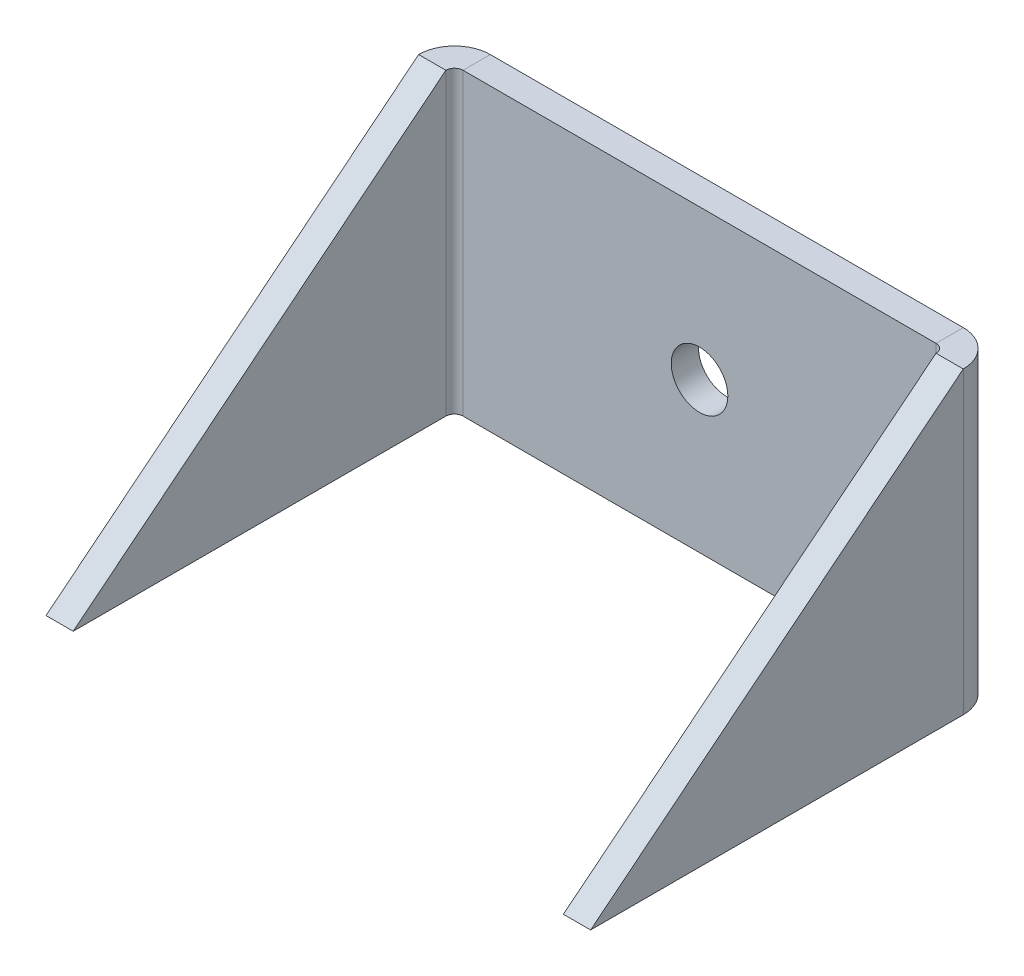
from build123d import *

# Parameters (mm, degrees)
SKETCH2_W                    = 57.15
SKETCH2_H                    = 34.925
BASE_FLANGE1_DEPTH           = 3.175
EDGE_FLANGE1_STRIP_W         = 14.7
EDGE_FLANGE1_STRIP_H         = 3.175
EDGE_FLANGE1_STRIP_CUT_DEPTH = 34.925
EDGE_FLANGE1_DEPTH           = 34.925
CUT_EXTRUDE1_DEPTH           = 3.175
M6_CLEARANCE_HOLE1_D         = 6.6


# Sheet-metal steps are written as plain solids
with BuildPart() as part:
    # Sketch2 → Base-Flange1 (new body)
    with BuildSketch(Plane.XY):
        Rectangle(SKETCH2_W, SKETCH2_H)
    extrude(amount=BASE_FLANGE1_DEPTH)

    # Edge-Flange1 strip (across the edge) → Edge-Flange1 strip cut (cut)
    with BuildSketch(Plane(origin=(28.575, -17.4625, 3.175), x_dir=(-1, 0, 0), z_dir=(0, 1, 0))):
        with Locations((-6.35, -1.5875)):
            Rectangle(EDGE_FLANGE1_STRIP_W, EDGE_FLANGE1_STRIP_H)
    edge_flange1_strip_cut = extrude(amount=EDGE_FLANGE1_STRIP_CUT_DEPTH, mode=Mode.SUBTRACT)

    # Edge-Flange1 section (across the edge) → Edge-Flange1 (add)
    with BuildSketch(Plane(origin=(28.575, -17.4625, 3.175), x_dir=(-1, 0, 0), z_dir=(0, 1, 0))):
        with BuildLine():
            Line((-3.175, 1), (-3.175, 44.45))
            Line((-3.175, 44.45), (0, 44.45))
            Line((0, 44.45), (0, 1))
            ThreePointArc((0, 1), (0.292893219, 0.292893219), (1, 0))
            Line((1, 0), (1, -3.175))
            ThreePointArc((1, -3.175), (-1.952170811, -1.952170811), (-3.175, 1))
        make_face()
    edge_flange1 = extrude(amount=EDGE_FLANGE1_DEPTH)

    # Sketch10 → Cut-Extrude1 (cut)
    with BuildSketch(Plane(origin=(31.75, 0, 0), x_dir=(0, 0, -1), z_dir=(1, 0, 0))):
        Polygon((-4.175, 17.4625), (-47.625, -17.4625), (-47.625, 17.4625), align=None)
    cut_extrude1 = extrude(amount=-CUT_EXTRUDE1_DEPTH, mode=Mode.SUBTRACT)

    # Mirror1: Edge-Flange1 strip cut, Edge-Flange1, Cut-Extrude1 across plane
    add(edge_flange1_strip_cut.mirror(Plane(origin=(0, 0, 0), x_dir=(0, 0, 1), z_dir=(1, 0, 0))), mode=Mode.SUBTRACT)
    add(edge_flange1.mirror(Plane(origin=(0, 0, 0), x_dir=(0, 0, 1), z_dir=(1, 0, 0))))
    add(cut_extrude1.mirror(Plane(origin=(0, 0, 0), x_dir=(0, 0, 1), z_dir=(1, 0, 0))), mode=Mode.SUBTRACT)

    # M6 Clearance Hole1 (through all)
    with Locations(Plane.XY.offset(3.175)):
        with Locations((0, 0)):
            Hole(M6_CLEARANCE_HOLE1_D / 2)


solid = part.part
